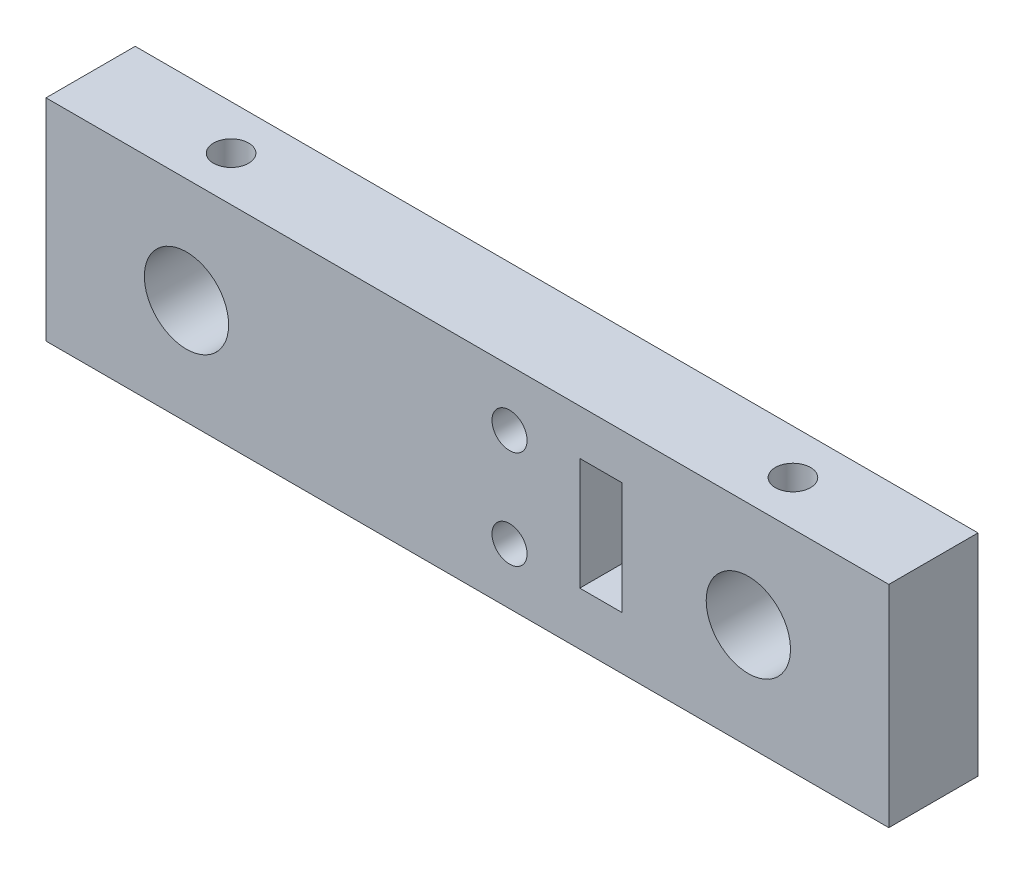
from build123d import *

# Parameters (mm, degrees)
SKETCH1_W             = 60
SKETCH1_H             = 15
SKETCH1_R             = 3
BOSS_EXTRUDE1_DEPTH   = 6.35
M3_TAPPED_HOLE1_D     = 2.5
M3_TAPPED_HOLE1_DEPTH = 8.5
M3_TAPPED_HOLE1_TIP   = 0.751075774
SKETCH5_W             = 3
SKETCH5_H             = 8
CUT_EXTRUDE1_DEPTH    = 63.171717881
M3_TAPPED_HOLE2_D     = 2.5


with BuildPart() as part:
    # Sketch1 → Boss-Extrude1 (new body)
    with BuildSketch(Plane.XY):
        with Locations((30, 7.5)):
            Rectangle(SKETCH1_W, SKETCH1_H)
        with Locations((10, 7.5)):
            Circle(SKETCH1_R, mode=Mode.SUBTRACT)
        with Locations((50, 7.5)):
            Circle(SKETCH1_R, mode=Mode.SUBTRACT)
    extrude(amount=BOSS_EXTRUDE1_DEPTH)

    # M3 Tapped Hole1
    with Locations(Plane(origin=(0, 15, 0), x_dir=(-1, 0, 0), z_dir=(0, 1, 0))):
        with Locations((-10, 3.175), (-50, 3.175)):
            Hole(M3_TAPPED_HOLE1_D / 2, depth=M3_TAPPED_HOLE1_DEPTH)
            with Locations((0, 0, -(M3_TAPPED_HOLE1_DEPTH + M3_TAPPED_HOLE1_TIP / 2))):  # 118° drill point
                Cone(0, M3_TAPPED_HOLE1_D / 2, M3_TAPPED_HOLE1_TIP, mode=Mode.SUBTRACT)

    # Sketch5 → Cut-Extrude1 (cut, through all)
    with BuildSketch(Plane.XY.offset(6.35)):
        with Locations((39.5, 7.769310746)):
            Rectangle(SKETCH5_W, SKETCH5_H)
    extrude(amount=-CUT_EXTRUDE1_DEPTH, mode=Mode.SUBTRACT)

    # M3 Tapped Hole2 (through all)
    with Locations(Plane.XY.offset(6.35)):
        with Locations((33, 11), (33, 4)):
            Hole(M3_TAPPED_HOLE2_D / 2)


solid = part.part
